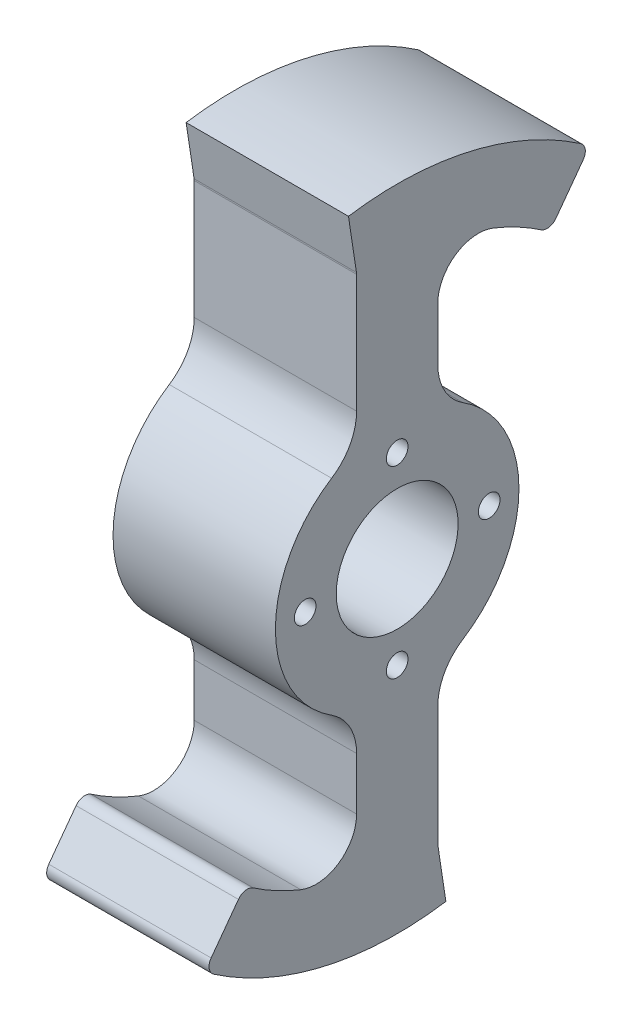
from build123d import *

# Parameters (mm, degrees)
SKETCH1_R           = 14.3002
BOSS_EXTRUDE1_DEPTH = 19.05
FILLET1_R           = 2.54
FILLET2_R           = 12.7
CUT_EXTRUDE1_REACH  = 97.956
SKETCH2_R           = 2.54


with BuildPart() as part:
    # Sketch1 → Boss-Extrude1 (new, symmetric)
    with BuildSketch(Plane(origin=(0, 0, 0), x_dir=(0, 0, -1), z_dir=(1, 0, 0))):
        with BuildLine():
            Line((-9.525, 62.781560788), (-9.525, 26.940768363))
            ThreePointArc((-9.525, 26.940768363), (-28.575, 0), (-9.525, -26.940768363))
            Line((-9.525, -26.940768363), (-9.525, -47.092860393))
            ThreePointArc((-9.525, -47.092860393), (-13.725363129, -54.990573175), (-22.621875, -55.922771717))
            ThreePointArc((-22.621875, -55.922771717), (-28.358874995, -53.243589605), (-33.783451818, -49.97783517))
            ThreePointArc((-33.783451818, -49.97783517), (-35.637578095, -49.579113893), (-37.251051326, -50.57584206))
            Line((-37.251051326, -50.57584206), (-45.189690331, -61.354151349))
            ThreePointArc((-45.189690331, -61.354151349), (-18.270612749, -73.97719047), (11.43, -75.337872946))
            Line((11.43, -75.337872946), (9.525, -62.781560788))
            Line((9.525, -62.781560788), (9.525, -26.940768363))
            ThreePointArc((9.525, -26.940768363), (28.575, 0), (9.525, 26.940768363))
            Line((9.525, 26.940768363), (9.525, 47.092860393))
            ThreePointArc((9.525, 47.092860393), (13.725363129, 54.990573175), (22.621875, 55.922771717))
            ThreePointArc((22.621875, 55.922771717), (28.358874995, 53.243589605), (33.783451818, 49.97783517))
            ThreePointArc((33.783451818, 49.97783517), (35.637578095, 49.579113893), (37.251051326, 50.57584206))
            Line((37.251051326, 50.57584206), (45.189690331, 61.354151349))
            ThreePointArc((45.189690331, 61.354151349), (18.270612749, 73.97719047), (-11.43, 75.337872946))
            Line((-11.43, 75.337872946), (-9.525, 62.781560788))
        make_face()
        Circle(SKETCH1_R, mode=Mode.SUBTRACT)
    extrude(amount=BOSS_EXTRUDE1_DEPTH, both=True)

    # Fillet1
    fillet1_edges = [part.edges().sort_by_distance(p)[0] for p in [
        (0, -61.354151349, 45.189690331),
        (0, 61.354151349, -45.189690331),
        (0, -62.781560788, -9.525),
        (0, 62.781560788, 9.525),
    ]]
    fillet(fillet1_edges, radius=FILLET1_R)

    # Fillet2
    fillet2_edges = [part.edges().sort_by_distance(p)[0] for p in [
        (0, 26.940768363, -9.525),
        (0, -26.940768363, -9.525),
        (0, -26.940768363, 9.525),
        (0, 26.940768363, 9.525),
    ]]
    fillet(fillet2_edges, radius=FILLET2_R)

    # Sketch2 → Cut-Extrude1 (cut, up to next)
    with BuildSketch(Plane.ZY.offset(19.05), mode=Mode.PRIVATE) as cut_extrude1_sk1:
        with Locations((0, 21.59)):
            Circle(SKETCH2_R)
    cut_extrude1_tool1 = extrude(cut_extrude1_sk1.sketch, amount=-CUT_EXTRUDE1_REACH, mode=Mode.PRIVATE) & part.part
    # Sketch2 → Cut-Extrude1 (cut, up to next)
    with BuildSketch(Plane.ZY.offset(19.05), mode=Mode.PRIVATE) as cut_extrude1_sk2:
        with Locations((21.59, 0)):
            Circle(SKETCH2_R)
    cut_extrude1_tool2 = extrude(cut_extrude1_sk2.sketch, amount=-CUT_EXTRUDE1_REACH, mode=Mode.PRIVATE) & part.part
    # Sketch2 → Cut-Extrude1 (cut, up to next)
    with BuildSketch(Plane.ZY.offset(19.05), mode=Mode.PRIVATE) as cut_extrude1_sk3:
        with Locations((0, -21.59)):
            Circle(SKETCH2_R)
    cut_extrude1_tool3 = extrude(cut_extrude1_sk3.sketch, amount=-CUT_EXTRUDE1_REACH, mode=Mode.PRIVATE) & part.part
    # Sketch2 → Cut-Extrude1 (cut, up to next)
    with BuildSketch(Plane.ZY.offset(19.05), mode=Mode.PRIVATE) as cut_extrude1_sk4:
        with Locations((-21.59, 0)):
            Circle(SKETCH2_R)
    cut_extrude1_tool4 = extrude(cut_extrude1_sk4.sketch, amount=-CUT_EXTRUDE1_REACH, mode=Mode.PRIVATE) & part.part
    add(cut_extrude1_tool1.solids().sort_by_distance((-19.05, 21.59, 0))[0], mode=Mode.SUBTRACT)
    add(cut_extrude1_tool2.solids().sort_by_distance((-19.05, 0, 21.59))[0], mode=Mode.SUBTRACT)
    add(cut_extrude1_tool3.solids().sort_by_distance((-19.05, -21.59, 0))[0], mode=Mode.SUBTRACT)
    add(cut_extrude1_tool4.solids().sort_by_distance((-19.05, 0, -21.59))[0], mode=Mode.SUBTRACT)


solid = part.part
